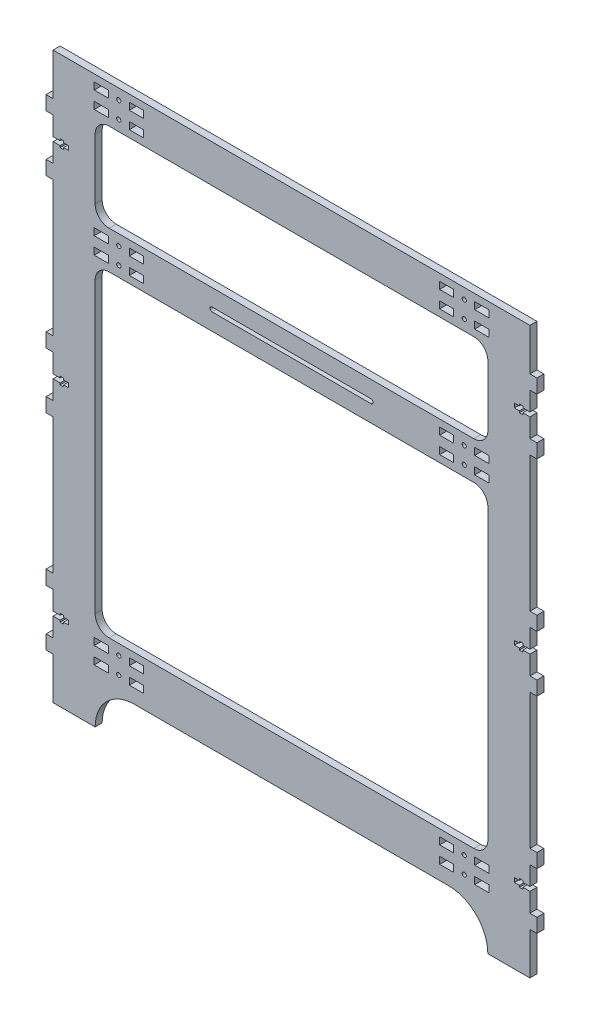
from build123d import *

# Parameters (mm, degrees)
SKETCH1_SIDE_SKETCH_2_W = 10
SKETCH1_SIDE_SKETCH_2_H = 5
SKETCH1_SIDE_SKETCH_2_R = 1.5
BOSS_EXTRUDE1_DEPTH     = 5


with BuildPart() as part:
    # Sketch1-Side Sketch<2> → Boss-Extrude1 (new body)
    with BuildSketch(Plane.XY):
        with BuildLine():
            Line((170, 100), (-170, 100))
            Line((-170, 100), (-170, 70))
            Line((-170, 70), (-175, 70))
            Line((-175, 70), (-175, 60))
            Line((-175, 60), (-170, 60))
            Line((-170, 60), (-170, 46.5))
            Line((-170, 46.5), (-165, 46.5))
            Line((-165, 46.5), (-165, 47.75))
            Line((-165, 47.75), (-162.5, 47.75))
            Line((-162.5, 47.75), (-162.5, 46.5))
            Line((-162.5, 46.5), (-159, 46.5))
            Line((-159, 46.5), (-159, 43.5))
            Line((-159, 43.5), (-162.5, 43.5))
            Line((-162.5, 43.5), (-162.5, 42.25))
            Line((-162.5, 42.25), (-165, 42.25))
            Line((-165, 42.25), (-165, 43.5))
            Line((-165, 43.5), (-170, 43.5))
            Line((-170, 43.5), (-170, 30))
            Line((-170, 30), (-175, 30))
            Line((-175, 30), (-175, 20))
            Line((-175, 20), (-170, 20))
            Line((-170, 20), (-170, -76.5))
            Line((-170, -76.5), (-175, -76.5))
            Line((-175, -76.5), (-175, -86.5))
            Line((-175, -86.5), (-170, -86.5))
            Line((-170, -86.5), (-170, -100))
            Line((-170, -100), (-165, -100))
            Line((-165, -100), (-165, -98.75))
            Line((-165, -98.75), (-162.5, -98.75))
            Line((-162.5, -98.75), (-162.5, -100))
            Line((-162.5, -100), (-159, -100))
            Line((-159, -100), (-159, -103))
            Line((-159, -103), (-162.5, -103))
            Line((-162.5, -103), (-162.5, -104.25))
            Line((-162.5, -104.25), (-165, -104.25))
            Line((-165, -104.25), (-165, -103))
            Line((-165, -103), (-170, -103))
            Line((-170, -103), (-170, -116.5))
            Line((-170, -116.5), (-175, -116.5))
            Line((-175, -116.5), (-175, -126.5))
            Line((-175, -126.5), (-170, -126.5))
            Line((-170, -126.5), (-170, -223))
            Line((-170, -223), (-175, -223))
            Line((-175, -223), (-175, -233))
            Line((-175, -233), (-170, -233))
            Line((-170, -233), (-170, -246.5))
            Line((-170, -246.5), (-165, -246.5))
            Line((-165, -246.5), (-165, -245.25))
            Line((-165, -245.25), (-162.5, -245.25))
            Line((-162.5, -245.25), (-162.5, -246.5))
            Line((-162.5, -246.5), (-159, -246.5))
            Line((-159, -246.5), (-159, -249.5))
            Line((-159, -249.5), (-162.5, -249.5))
            Line((-162.5, -249.5), (-162.5, -250.75))
            Line((-162.5, -250.75), (-165, -250.75))
            Line((-165, -250.75), (-165, -249.5))
            Line((-165, -249.5), (-170, -249.5))
            Line((-170, -249.5), (-170, -263))
            Line((-170, -263), (-175, -263))
            Line((-175, -263), (-175, -273))
            Line((-175, -273), (-170, -273))
            Line((-170, -273), (-170, -303))
            Line((-170, -303), (-140, -303))
            ThreePointArc((-140, -303), (-131.798989873, -283.201010127), (-112, -275))
            Line((-112, -275), (112, -275))
            ThreePointArc((112, -275), (131.798989873, -283.201010127), (140, -303))
            Line((140, -303), (170, -303))
            Line((170, -303), (170, -273))
            Line((170, -273), (175, -273))
            Line((175, -273), (175, -263))
            Line((175, -263), (170, -263))
            Line((170, -263), (170, -249.5))
            Line((170, -249.5), (165, -249.5))
            Line((165, -249.5), (165, -250.75))
            Line((165, -250.75), (162.5, -250.75))
            Line((162.5, -250.75), (162.5, -249.5))
            Line((162.5, -249.5), (159, -249.5))
            Line((159, -249.5), (159, -246.5))
            Line((159, -246.5), (162.5, -246.5))
            Line((162.5, -246.5), (162.5, -245.25))
            Line((162.5, -245.25), (165, -245.25))
            Line((165, -245.25), (165, -246.5))
            Line((165, -246.5), (170, -246.5))
            Line((170, -246.5), (170, -233))
            Line((170, -233), (175, -233))
            Line((175, -233), (175, -223))
            Line((175, -223), (170, -223))
            Line((170, -223), (170, -126.5))
            Line((170, -126.5), (175, -126.5))
            Line((175, -126.5), (175, -116.5))
            Line((175, -116.5), (170, -116.5))
            Line((170, -116.5), (170, -103))
            Line((170, -103), (165, -103))
            Line((165, -103), (165, -104.25))
            Line((165, -104.25), (162.5, -104.25))
            Line((162.5, -104.25), (162.5, -103))
            Line((162.5, -103), (159, -103))
            Line((159, -103), (159, -100))
            Line((159, -100), (162.5, -100))
            Line((162.5, -100), (162.5, -98.75))
            Line((162.5, -98.75), (165, -98.75))
            Line((165, -98.75), (165, -100))
            Line((165, -100), (170, -100))
            Line((170, -100), (170, -86.5))
            Line((170, -86.5), (175, -86.5))
            Line((175, -86.5), (175, -76.5))
            Line((175, -76.5), (170, -76.5))
            Line((170, -76.5), (170, 20))
            Line((170, 20), (175, 20))
            Line((175, 20), (175, 30))
            Line((175, 30), (170, 30))
            Line((170, 30), (170, 43.5))
            Line((170, 43.5), (165, 43.5))
            Line((165, 43.5), (165, 42.25))
            Line((165, 42.25), (162.5, 42.25))
            Line((162.5, 42.25), (162.5, 43.5))
            Line((162.5, 43.5), (159, 43.5))
            Line((159, 43.5), (159, 46.5))
            Line((159, 46.5), (162.5, 46.5))
            Line((162.5, 46.5), (162.5, 47.75))
            Line((162.5, 47.75), (165, 47.75))
            Line((165, 47.75), (165, 46.5))
            Line((165, 46.5), (170, 46.5))
            Line((170, 46.5), (170, 60))
            Line((170, 60), (175, 60))
            Line((175, 60), (175, 70))
            Line((175, 70), (170, 70))
            Line((170, 70), (170, 100))
        make_face()
        with Locations((-135.653282912, -262.5)):
            Rectangle(SKETCH1_SIDE_SKETCH_2_W, SKETCH1_SIDE_SKETCH_2_H, mode=Mode.SUBTRACT)
        with Locations((-123.153282912, -262.5)):
            Circle(SKETCH1_SIDE_SKETCH_2_R, mode=Mode.SUBTRACT)
        with Locations((-110.653282912, -262.5)):
            Rectangle(SKETCH1_SIDE_SKETCH_2_W, SKETCH1_SIDE_SKETCH_2_H, mode=Mode.SUBTRACT)
        with Locations((-135.653282912, -250.5)):
            Rectangle(SKETCH1_SIDE_SKETCH_2_W, SKETCH1_SIDE_SKETCH_2_H, mode=Mode.SUBTRACT)
        with Locations((-123.153282912, -250.5)):
            Circle(SKETCH1_SIDE_SKETCH_2_R, mode=Mode.SUBTRACT)
        with Locations((-110.653282912, -250.5)):
            Rectangle(SKETCH1_SIDE_SKETCH_2_W, SKETCH1_SIDE_SKETCH_2_H, mode=Mode.SUBTRACT)
        with Locations((110.653282912, -262.5)):
            Rectangle(SKETCH1_SIDE_SKETCH_2_W, SKETCH1_SIDE_SKETCH_2_H, mode=Mode.SUBTRACT)
        with Locations((123.153282912, -262.5)):
            Circle(SKETCH1_SIDE_SKETCH_2_R, mode=Mode.SUBTRACT)
        with Locations((135.653282912, -262.5)):
            Rectangle(SKETCH1_SIDE_SKETCH_2_W, SKETCH1_SIDE_SKETCH_2_H, mode=Mode.SUBTRACT)
        with Locations((110.653282912, -250.5)):
            Rectangle(SKETCH1_SIDE_SKETCH_2_W, SKETCH1_SIDE_SKETCH_2_H, mode=Mode.SUBTRACT)
        with Locations((123.153282912, -250.5)):
            Circle(SKETCH1_SIDE_SKETCH_2_R, mode=Mode.SUBTRACT)
        with Locations((135.653282912, -250.5)):
            Rectangle(SKETCH1_SIDE_SKETCH_2_W, SKETCH1_SIDE_SKETCH_2_H, mode=Mode.SUBTRACT)
        with BuildLine():
            Line((-130, -17), (130, -17))
            ThreePointArc((130, -17), (137.071067812, -19.928932188), (140, -27))
            Line((140, -27), (140, -233))
            ThreePointArc((140, -233), (137.071067812, -240.071067812), (130, -243))
            Line((130, -243), (-130, -243))
            ThreePointArc((-130, -243), (-137.071067812, -240.071067812), (-140, -233))
            Line((-140, -233), (-140, -27))
            ThreePointArc((-140, -27), (-137.071067812, -19.928932188), (-130, -17))
        make_face(mode=Mode.SUBTRACT)
        with Locations((-135.653282912, -9.5)):
            Rectangle(SKETCH1_SIDE_SKETCH_2_W, SKETCH1_SIDE_SKETCH_2_H, mode=Mode.SUBTRACT)
        with Locations((-123.153282912, -9.5)):
            Circle(SKETCH1_SIDE_SKETCH_2_R, mode=Mode.SUBTRACT)
        with Locations((-110.653282912, -9.5)):
            Rectangle(SKETCH1_SIDE_SKETCH_2_W, SKETCH1_SIDE_SKETCH_2_H, mode=Mode.SUBTRACT)
        with Locations((-135.653282912, 2.5)):
            Rectangle(SKETCH1_SIDE_SKETCH_2_W, SKETCH1_SIDE_SKETCH_2_H, mode=Mode.SUBTRACT)
        with Locations((-123.153282912, 2.5)):
            Circle(SKETCH1_SIDE_SKETCH_2_R, mode=Mode.SUBTRACT)
        with Locations((-110.653282912, 2.5)):
            Rectangle(SKETCH1_SIDE_SKETCH_2_W, SKETCH1_SIDE_SKETCH_2_H, mode=Mode.SUBTRACT)
        with Locations((-135.653282912, 80.5)):
            Rectangle(SKETCH1_SIDE_SKETCH_2_W, SKETCH1_SIDE_SKETCH_2_H, mode=Mode.SUBTRACT)
        with Locations((-135.653282912, 92.5)):
            Rectangle(SKETCH1_SIDE_SKETCH_2_W, SKETCH1_SIDE_SKETCH_2_H, mode=Mode.SUBTRACT)
        with Locations((-123.153282912, 80.5)):
            Circle(SKETCH1_SIDE_SKETCH_2_R, mode=Mode.SUBTRACT)
        with Locations((-123.153282912, 92.5)):
            Circle(SKETCH1_SIDE_SKETCH_2_R, mode=Mode.SUBTRACT)
        with Locations((-110.653282912, 80.5)):
            Rectangle(SKETCH1_SIDE_SKETCH_2_W, SKETCH1_SIDE_SKETCH_2_H, mode=Mode.SUBTRACT)
        with Locations((-110.653282912, 92.5)):
            Rectangle(SKETCH1_SIDE_SKETCH_2_W, SKETCH1_SIDE_SKETCH_2_H, mode=Mode.SUBTRACT)
        with BuildLine():
            Line((-130, 73), (130, 73))
            ThreePointArc((130, 73), (137.071067812, 70.071067812), (140, 63))
            Line((140, 63), (140, 20))
            ThreePointArc((140, 20), (137.071067812, 12.928932188), (130, 10))
            Line((130, 10), (-130, 10))
            ThreePointArc((-130, 10), (-137.071067812, 12.928932188), (-140, 20))
            Line((-140, 20), (-140, 63))
            ThreePointArc((-140, 63), (-137.071067812, 70.071067812), (-130, 73))
        make_face(mode=Mode.SUBTRACT)
        with BuildLine():
            ThreePointArc((-56.666666667, -5), (-58.166666667, -3.5), (-56.666666667, -2))
            Line((-56.666666667, -2), (56.666666667, -2))
            ThreePointArc((56.666666667, -2), (58.166666667, -3.5), (56.666666667, -5))
            Line((56.666666667, -5), (-56.666666667, -5))
        make_face(mode=Mode.SUBTRACT)
        with Locations((110.653282912, -9.5)):
            Rectangle(SKETCH1_SIDE_SKETCH_2_W, SKETCH1_SIDE_SKETCH_2_H, mode=Mode.SUBTRACT)
        with Locations((123.153282912, -9.5)):
            Circle(SKETCH1_SIDE_SKETCH_2_R, mode=Mode.SUBTRACT)
        with Locations((135.653282912, -9.5)):
            Rectangle(SKETCH1_SIDE_SKETCH_2_W, SKETCH1_SIDE_SKETCH_2_H, mode=Mode.SUBTRACT)
        with Locations((110.653282912, 2.5)):
            Rectangle(SKETCH1_SIDE_SKETCH_2_W, SKETCH1_SIDE_SKETCH_2_H, mode=Mode.SUBTRACT)
        with Locations((123.153282912, 2.5)):
            Circle(SKETCH1_SIDE_SKETCH_2_R, mode=Mode.SUBTRACT)
        with Locations((135.653282912, 2.5)):
            Rectangle(SKETCH1_SIDE_SKETCH_2_W, SKETCH1_SIDE_SKETCH_2_H, mode=Mode.SUBTRACT)
        with Locations((110.653282912, 80.5)):
            Rectangle(SKETCH1_SIDE_SKETCH_2_W, SKETCH1_SIDE_SKETCH_2_H, mode=Mode.SUBTRACT)
        with Locations((110.653282912, 92.5)):
            Rectangle(SKETCH1_SIDE_SKETCH_2_W, SKETCH1_SIDE_SKETCH_2_H, mode=Mode.SUBTRACT)
        with Locations((123.153282912, 80.5)):
            Circle(SKETCH1_SIDE_SKETCH_2_R, mode=Mode.SUBTRACT)
        with Locations((123.153282912, 92.5)):
            Circle(SKETCH1_SIDE_SKETCH_2_R, mode=Mode.SUBTRACT)
        with Locations((135.653282912, 80.5)):
            Rectangle(SKETCH1_SIDE_SKETCH_2_W, SKETCH1_SIDE_SKETCH_2_H, mode=Mode.SUBTRACT)
        with Locations((135.653282912, 92.5)):
            Rectangle(SKETCH1_SIDE_SKETCH_2_W, SKETCH1_SIDE_SKETCH_2_H, mode=Mode.SUBTRACT)
    extrude(amount=BOSS_EXTRUDE1_DEPTH)


solid = part.part
